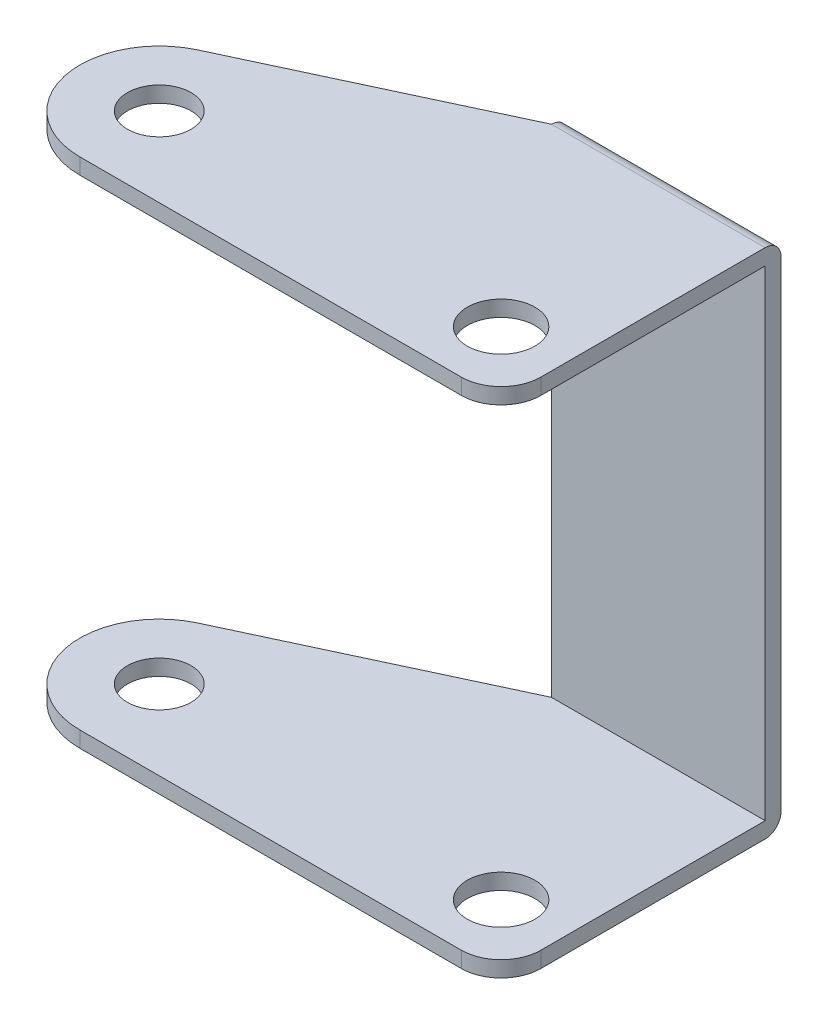
from build123d import *

# Parameters (mm, degrees)
SKETCH1_W                  = 75
SKETCH1_H                  = 130
BASE_FLANGE1_DEPTH         = 2
SKETCHED_START             = -37.5
SKETCHED_BEND1_DEPTH       = 75
SKETCHED_BEND1_2_OUTLINE_W = 2
SKETCHED_BEND1_2_OUTLINE_H = 33.214601837
SKETCHED_BEND1_2_DEPTH     = 75
CUT_EXTRUDE1_START         = -64.429203673
CUT_EXTRUDE1_DEPTH         = 64.429203673
CUT_EXTRUDE2_DEPTH         = 82.61238914
CUT_EXTRUDE2_DEPTH_BACK    = 82.61238914
SKETCH9_R                  = 4
CUT_EXTRUDE3_DEPTH         = 82.61238914
CUT_EXTRUDE3_DEPTH_BACK    = 82.61238914
SKETCH10_R                 = 4.25
SKETCH10_W                 = 12
SKETCH10_H                 = 100
FILLET7_R                  = 5


# Read off the part's stored shape, not the designer's step: Sketched Bend1, Cut-Extrude1
# Sheet-metal steps are written as plain solids
with BuildPart() as part:
    # Sketch1 → Base-Flange1 (new body)
    with BuildSketch(Plane.XY):
        Rectangle(SKETCH1_W, SKETCH1_H)
    extrude(amount=-BASE_FLANGE1_DEPTH)

    # Sketched Bend1 outline → Sketched Bend1 (cut)
    with BuildSketch(Plane.YZ.offset(SKETCHED_START)):
        with BuildLine():
            Line((65, 0), (32.214601837, 0))
            ThreePointArc((32.214601837, 0), (31.628815399, -1.414213562), (30.214601837, -2))
            Line((30.214601837, -2), (65, -2))
            Line((65, -2), (65, 0))
        make_face()
        with BuildLine():
            Line((-65, -2), (-30.214601837, -2))
            ThreePointArc((-30.214601837, -2), (-31.628815399, -1.414213562), (-32.214601837, 0))
            Line((-32.214601837, 0), (-65, 0))
            Line((-65, 0), (-65, -2))
        make_face()
    extrude(amount=SKETCHED_BEND1_DEPTH, mode=Mode.SUBTRACT)

    # Sketched Bend1 2 outline → Sketched Bend1 2 (add)
    with BuildSketch(Plane.YZ.offset(SKETCHED_START)):
        with Locations((31.214601837, 16.607300919)):
            Rectangle(SKETCHED_BEND1_2_OUTLINE_W, SKETCHED_BEND1_2_OUTLINE_H)
        with Locations((-31.214601837, 16.607300919)):
            Rectangle(SKETCHED_BEND1_2_OUTLINE_W, SKETCHED_BEND1_2_OUTLINE_H)
    extrude(amount=SKETCHED_BEND1_2_DEPTH)

    # Cut-Extrude1 outline → Cut-Extrude1 (cut)
    with BuildSketch(Plane(origin=(0, 32.214601837, 0), x_dir=(1, 0, 0), z_dir=(0, 1, 0)).offset(CUT_EXTRUDE1_START)):
        with BuildLine():
            Line((-37.5, -33.214601837), (-27.5, -33.214601837))
            ThreePointArc((-27.5, -33.214601837), (-34.571067812, -30.285669649), (-37.5, -23.214601837))
            Line((-37.5, -23.214601837), (-37.5, -33.214601837))
        make_face()
        with BuildLine():
            ThreePointArc((-37.5, -23.214601837), (-35.933914458, -17.841605753), (-31.726182617, -14.151523966))
            Line((-31.726182617, -14.151523966), (-1.378141536, 0))
            Line((-1.378141536, 0), (-1.378141536, 2))
            Line((-1.378141536, 2), (-37.5, 2))
            Line((-37.5, 2), (-37.5, -23.214601837))
        make_face()
    extrude(amount=CUT_EXTRUDE1_DEPTH, mode=Mode.SUBTRACT)

    # Sketch9 → Cut-Extrude2 (cut, two sides: drawn at the far end of the back side and taken through both)
    with BuildSketch(Plane(origin=(0, 32.214601837, 0), x_dir=(1, 0, 0), z_dir=(0, 1, 0)).offset(-CUT_EXTRUDE2_DEPTH_BACK)):
        with Locations(Location((-27.5, -23.214601837, 0), (0, 0, 270))):
            Circle(SKETCH9_R)
    extrude(amount=CUT_EXTRUDE2_DEPTH + CUT_EXTRUDE2_DEPTH_BACK, mode=Mode.SUBTRACT)

    # Sketch10 → Cut-Extrude3 (cut, two sides: drawn at the far end of the back side and taken through both)
    with BuildSketch(Plane(origin=(0, 32.214601837, 0), x_dir=(1, 0, 0), z_dir=(0, 1, 0)).offset(-CUT_EXTRUDE3_DEPTH_BACK)):
        with Locations(Location((17.5, -25.214601837, 0), (0, 0, 270))):
            Circle(SKETCH10_R)
        with Locations((31.5, 16.785398163)):
            Rectangle(SKETCH10_W, SKETCH10_H)
    extrude(amount=CUT_EXTRUDE3_DEPTH + CUT_EXTRUDE3_DEPTH_BACK, mode=Mode.SUBTRACT)

    # Fillet7
    fillet7_edges = [part.edges().sort_by_distance(p)[0] for p in [
        (25.5, 31.214601837, 33.214601837),
        (25.5, -31.214601837, 33.214601837),
    ]]
    fillet(fillet7_edges, radius=FILLET7_R)


solid = part.part
